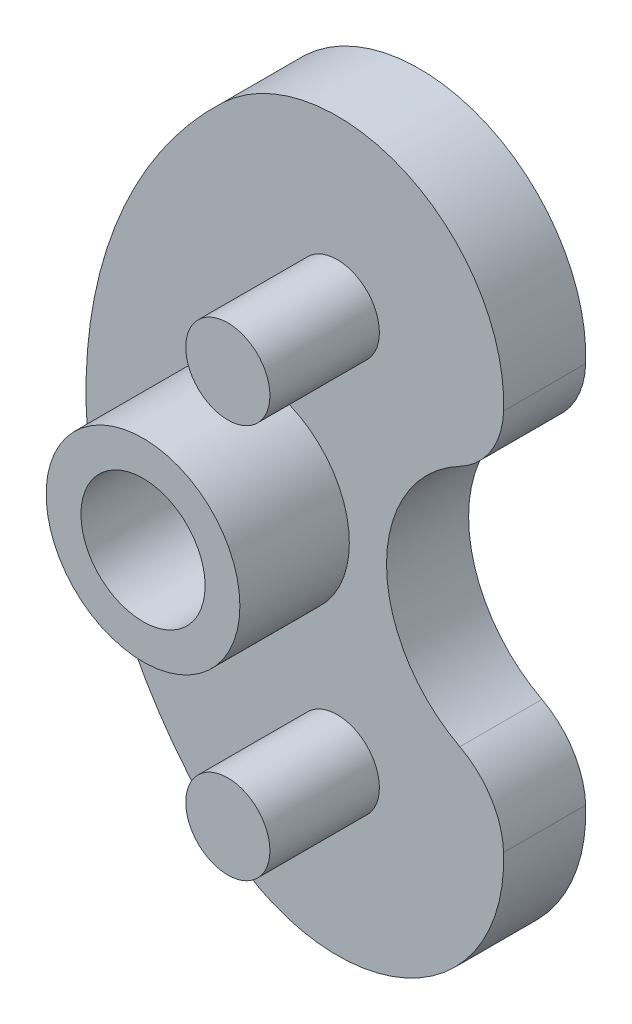
from build123d import *

# Parameters (mm, degrees)
PART2_1_START         = -21.745
PART2_1_OUTLINE_R     = 2.268804718
PART2_1_DEPTH         = 3
PART2_1_START_2       = -18.745
PART2_1_2_OUTLINE_R   = 1.538851722
PART2_1_2_OUTLINE_R_2 = 3.540835997
PART2_1_2_OUTLINE_R_3 = 2.268804718
PART2_1_2_DEPTH       = 5
SKETCH_1_W            = 9.919146705
SKETCH_1_H            = 22.592426062
CUT_EXTRUDE_1_DEPTH   = 1


# Read off the part's stored shape, not the designer's step: 基体零件-part2-1
with BuildPart() as part:
    # 基体零件-part2-1 outline → 基体零件-part2-1 (new body)
    with BuildSketch(Plane.XY.offset(PART2_1_START)):
        with BuildLine():
            ThreePointArc((-0.73742282, -6.986834522), (-1.194921758, -5.497574164), (-2.33759914, -4.438569872))
            ThreePointArc((-2.33759914, -4.438569872), (-5.0165, 0), (-2.33759914, 4.438569872))
            ThreePointArc((-2.33759914, 4.438569872), (-1.194921758, 5.497574164), (-0.73742282, 6.986834522))
            ThreePointArc((-0.73742282, 6.986834522), (-4.313555127, 12.746389448), (-10.998808821, 11.620077647))
            ThreePointArc((-10.998808821, 11.620077647), (-16, 0), (-10.998808821, -11.620077647))
            ThreePointArc((-10.998808821, -11.620077647), (-4.313555127, -12.746389448), (-0.73742282, -6.986834522))
        make_face()
        with Locations((-9.916654285, 0)):
            Circle(PART2_1_OUTLINE_R, mode=Mode.SUBTRACT)
    extrude(amount=PART2_1_DEPTH)

    # part2-1 2 outline → part2-1 2 (add)
    # profile 1 of 3: a face of its own
    with BuildSketch(Plane.XY.offset(PART2_1_START_2)):
        with Locations((-6.816961539, -7.2020183)):
            Circle(PART2_1_2_OUTLINE_R)
    # profile 2 of 3: a face of its own
    with BuildSketch(Plane.XY.offset(PART2_1_START_2)):
        with Locations((-9.916654285, 0)):
            Circle(PART2_1_2_OUTLINE_R_2)
        with Locations((-9.916654285, 0)):
            Circle(PART2_1_2_OUTLINE_R_3, mode=Mode.SUBTRACT)
    # profile 3 of 3: a face of its own
    with BuildSketch(Plane.XY.offset(PART2_1_START_2)):
        with Locations((-6.816961539, 7.2020183)):
            Circle(PART2_1_2_OUTLINE_R)
    extrude(amount=PART2_1_2_DEPTH)

    # 草图1 → 切除-拉伸1 (cut)
    with BuildSketch(Plane.XY.offset(-13.745)):
        with Locations((-9.361869936, 0)):
            Rectangle(SKETCH_1_W, SKETCH_1_H)
    extrude(amount=-CUT_EXTRUDE_1_DEPTH, mode=Mode.SUBTRACT)


solid = part.part
